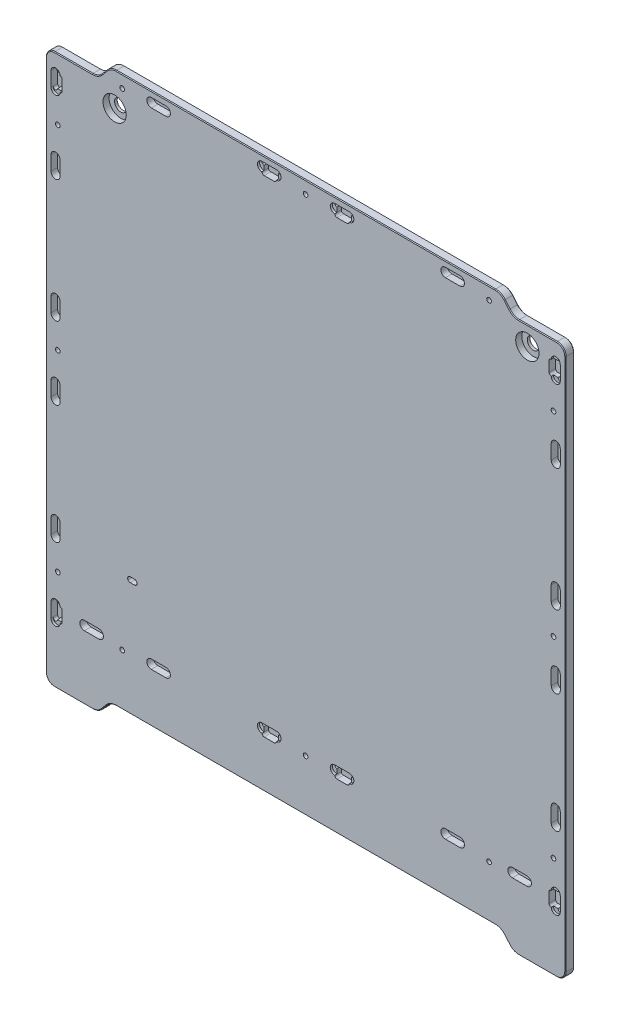
from build123d import *

# Parameters (mm, degrees)
CROQUIS1_W                                           = 357
CROQUIS1_H                                           = 388
SALIENTE_EXTRUIR1_DEPTH                              = 6
CORTAR_EXTRUIR1_DEPTH                                = 1.5
CORTAR_EXTRUIR2_DEPTH                                = 3
CORTAR_EXTRUIR3_DEPTH                                = 1.5
CORTAR_EXTRUIR4_DEPTH                                = 3
CORTAR_EXTRUIR5_DEPTH                                = 1.5
CORTAR_EXTRUIR6_DEPTH                                = 3
CORTAR_EXTRUIR7_DEPTH                                = 1.5
CORTAR_EXTRUIR8_DEPTH                                = 3
CROQUIS10_W                                          = 44.391351397
CROQUIS10_H                                          = 10.000423175
CORTAR_EXTRUIR9_DEPTH                                = 264.693477356
CROQUIS11_W                                          = 268.217297206
CROQUIS11_H                                          = 10.000423175
CORTAR_EXTRUIR10_DEPTH                               = 264.693477356
CORTAR_EXTRUIR11_DEPTH                               = 264.693477356
CORTAR_EXTRUIR12_DEPTH                               = 4.5
CORTAR_EXTRUIR13_DEPTH                               = 4.5
CORTAR_EXTRUIR14_DEPTH                               = 4.5
CORTAR_EXTRUIR15_DEPTH                               = 4.5
CORTAR_EXTRUIR16_DEPTH                               = 4.5
CORTAR_EXTRUIR17_DEPTH                               = 4.5
CORTAR_EXTRUIR18_DEPTH                               = 4.5
NGULO_DE_SALIDA1_ANGLE                               = 40
NGULO_DE_SALIDA2_ANGLE                               = 40
DI_METRO_DE_TALADRO_3_2_3_2_1_D                      = 3.2
DI_METRO_DE_TALADRO_3_2_3_2_2_D                      = 3.2
REFRENTADO_PARA_PERNO_CON_CABEZA_HEXAGON_D           = 8.5
REFRENTADO_PARA_PERNO_CON_CABEZA_HEXAGON_CBORE_D     = 16
REFRENTADO_PARA_PERNO_CON_CABEZA_HEXAGON_CBORE_DEPTH = 4.2
REDONDEO1_R                                          = 6
REDONDEO2_R                                          = 8.5
CHAFL_N1_SIZE                                        = 0.5
REDONDEO3_R                                          = 1.5


with BuildPart() as part:
    # Croquis1 → Saliente-Extruir1 (new body)
    with BuildSketch(Plane.XY.offset(3)):
        Rectangle(CROQUIS1_W, CROQUIS1_H)
    extrude(amount=-SALIENTE_EXTRUIR1_DEPTH)

    # Croquis2 → Cortar-Extruir1 (cut)
    with BuildSketch(Plane.XY.offset(3)):
        with BuildLine():
            Line((-20, 182.4), (-20, 183.9))
            ThreePointArc((-20, 183.9), (-16.9, 187), (-20, 190.1))
            Line((-20, 190.1), (-30, 190.1))
            ThreePointArc((-30, 190.1), (-33.1, 187), (-30, 183.9))
            Line((-30, 183.9), (-30, 182.4))
            Line((-30, 182.4), (-20, 182.4))
        make_face()
    cortar_extruir1 = extrude(amount=-CORTAR_EXTRUIR1_DEPTH, mode=Mode.SUBTRACT)

    # Croquis3 → Cortar-Extruir2 (cut)
    with BuildSketch(Plane.XY.offset(1.5)):
        with BuildLine():
            Line((-20, 190.1), (-30, 190.1))
            ThreePointArc((-30, 190.1), (-31.5, 188.6), (-30, 187.1))
            Line((-30, 187.1), (-30, 182.4))
            Line((-30, 182.4), (-20, 182.4))
            Line((-20, 182.4), (-20, 187.1))
            ThreePointArc((-20, 187.1), (-18.5, 188.6), (-20, 190.1))
        make_face()
    cortar_extruir2 = extrude(amount=-CORTAR_EXTRUIR2_DEPTH, mode=Mode.SUBTRACT)

    # Croquis4 → Cortar-Extruir3 (cut)
    with BuildSketch(Plane.XY.offset(3)):
        with BuildLine():
            Line((-167.2, 171.7), (-168.7, 171.7))
            ThreePointArc((-168.7, 171.7), (-171.8, 174.8), (-174.9, 171.7))
            Line((-174.9, 171.7), (-174.9, 161.7))
            ThreePointArc((-174.9, 161.7), (-171.8, 158.6), (-168.7, 161.7))
            Line((-168.7, 161.7), (-167.2, 161.7))
            Line((-167.2, 161.7), (-167.2, 171.7))
        make_face()
    cortar_extruir3 = extrude(amount=-CORTAR_EXTRUIR3_DEPTH, mode=Mode.SUBTRACT)

    # Croquis5 → Cortar-Extruir4 (cut)
    with BuildSketch(Plane.XY.offset(1.5)):
        with BuildLine():
            Line((-171.9, 161.7), (-167.2, 161.7))
            Line((-167.2, 161.7), (-167.2, 171.7))
            Line((-167.2, 171.7), (-171.9, 171.7))
            ThreePointArc((-171.9, 171.7), (-173.4, 173.2), (-174.9, 171.7))
            Line((-174.9, 171.7), (-174.9, 161.7))
            ThreePointArc((-174.9, 161.7), (-173.4, 160.2), (-171.9, 161.7))
        make_face()
    cortar_extruir4 = extrude(amount=-CORTAR_EXTRUIR4_DEPTH, mode=Mode.SUBTRACT)

    # Croquis6 → Cortar-Extruir5 (cut)
    with BuildSketch(Plane.XY.offset(3)):
        with BuildLine():
            Line((-167.2, -144.2), (-168.7, -144.2))
            ThreePointArc((-168.7, -144.2), (-171.8, -141.1), (-174.9, -144.2))
            Line((-174.9, -144.2), (-174.9, -154.2))
            ThreePointArc((-174.9, -154.2), (-171.8, -157.3), (-168.7, -154.2))
            Line((-168.7, -154.2), (-167.2, -154.2))
            Line((-167.2, -154.2), (-167.2, -144.2))
        make_face()
    cortar_extruir5 = extrude(amount=-CORTAR_EXTRUIR5_DEPTH, mode=Mode.SUBTRACT)

    # Croquis7 → Cortar-Extruir6 (cut)
    with BuildSketch(Plane.XY.offset(1.5)):
        with BuildLine():
            Line((-171.9, -154.2), (-167.2, -154.2))
            Line((-167.2, -154.2), (-167.2, -144.2))
            Line((-167.2, -144.2), (-171.9, -144.2))
            ThreePointArc((-171.9, -144.2), (-173.4, -142.7), (-174.9, -144.2))
            Line((-174.9, -144.2), (-174.9, -154.2))
            ThreePointArc((-174.9, -154.2), (-173.4, -155.7), (-171.9, -154.2))
        make_face()
    cortar_extruir6 = extrude(amount=-CORTAR_EXTRUIR6_DEPTH, mode=Mode.SUBTRACT)

    # Croquis8 → Cortar-Extruir7 (cut)
    with BuildSketch(Plane.XY.offset(3)):
        with BuildLine():
            Line((-20, -151.6), (-20, -150.1))
            ThreePointArc((-20, -150.1), (-16.9, -147), (-20, -143.9))
            Line((-20, -143.9), (-30, -143.9))
            ThreePointArc((-30, -143.9), (-33.1, -147), (-30, -150.1))
            Line((-30, -150.1), (-30, -151.6))
            Line((-30, -151.6), (-20, -151.6))
        make_face()
    cortar_extruir7 = extrude(amount=-CORTAR_EXTRUIR7_DEPTH, mode=Mode.SUBTRACT)

    # Croquis9 → Cortar-Extruir8 (cut)
    with BuildSketch(Plane.XY.offset(1.5)):
        with BuildLine():
            Line((-30, -146.9), (-30, -151.6))
            Line((-30, -151.6), (-20, -151.6))
            Line((-20, -151.6), (-20, -146.9))
            ThreePointArc((-20, -146.9), (-18.5, -145.4), (-20, -143.9))
            Line((-20, -143.9), (-30, -143.9))
            ThreePointArc((-30, -143.9), (-31.5, -145.4), (-30, -146.9))
        make_face()
    cortar_extruir8 = extrude(amount=-CORTAR_EXTRUIR8_DEPTH, mode=Mode.SUBTRACT)

    # Croquis10 → Cortar-Extruir9 (cut, through all)
    with BuildSketch(Plane(origin=(0, 0, -3), x_dir=(-1, 0, 0), z_dir=(0, 0, -1))):
        with Locations((156.304324302, 188.999788413)):
            Rectangle(CROQUIS10_W, CROQUIS10_H)
    cortar_extruir9 = extrude(amount=-CORTAR_EXTRUIR9_DEPTH, mode=Mode.SUBTRACT)

    # Croquis11 → Cortar-Extruir10 (cut, through all)
    with BuildSketch(Plane(origin=(0, 0, -3), x_dir=(-1, 0, 0), z_dir=(0, 0, -1))):
        with Locations((0, -188.999788413)):
            Rectangle(CROQUIS11_W, CROQUIS11_H)
    extrude(amount=-CORTAR_EXTRUIR10_DEPTH, mode=Mode.SUBTRACT)

    # Croquis12 → Cortar-Extruir11 (cut, through all)
    with BuildSketch(Plane(origin=(0, 0, -3), x_dir=(-1, 0, 0), z_dir=(0, 0, -1))):
        with BuildLine():
            Line((120.5, -102.25), (117.5, -102.25))
            ThreePointArc((117.5, -102.25), (115.75, -104), (117.5, -105.75))
            Line((117.5, -105.75), (120.5, -105.75))
            ThreePointArc((120.5, -105.75), (122.25, -104), (120.5, -102.25))
        make_face()
    extrude(amount=-CORTAR_EXTRUIR11_DEPTH, mode=Mode.SUBTRACT)

    # Croquis13 → Cortar-Extruir12 (cut)
    with BuildSketch(Plane.XY.offset(3)):
        with BuildLine():
            Line((-106, 183.9), (-96, 183.9))
            ThreePointArc((-96, 183.9), (-92.9, 187), (-96, 190.1))
            Line((-96, 190.1), (-106, 190.1))
            ThreePointArc((-106, 190.1), (-109.1, 187), (-106, 183.9))
        make_face()
    cortar_extruir12 = extrude(amount=-CORTAR_EXTRUIR12_DEPTH, mode=Mode.SUBTRACT)

    # Croquis14 → Cortar-Extruir13 (cut)
    with BuildSketch(Plane.XY.offset(3)):
        with BuildLine():
            Line((-168.7, 111.7), (-168.7, 121.7))
            ThreePointArc((-168.7, 121.7), (-171.8, 124.8), (-174.9, 121.7))
            Line((-174.9, 121.7), (-174.9, 111.7))
            ThreePointArc((-174.9, 111.7), (-171.8, 108.6), (-168.7, 111.7))
        make_face()
    cortar_extruir13 = extrude(amount=-CORTAR_EXTRUIR13_DEPTH, mode=Mode.SUBTRACT)

    # Croquis15 → Cortar-Extruir14 (cut)
    with BuildSketch(Plane.XY.offset(3)):
        with BuildLine():
            Line((-168.7, 27.5), (-168.7, 37.5))
            ThreePointArc((-168.7, 37.5), (-171.8, 40.6), (-174.9, 37.5))
            Line((-174.9, 37.5), (-174.9, 27.5))
            ThreePointArc((-174.9, 27.5), (-171.8, 24.4), (-168.7, 27.5))
        make_face()
    cortar_extruir14 = extrude(amount=-CORTAR_EXTRUIR14_DEPTH, mode=Mode.SUBTRACT)

    # Croquis16 → Cortar-Extruir15 (cut)
    with BuildSketch(Plane.XY.offset(3)):
        with BuildLine():
            Line((-168.7, -22.5), (-168.7, -12.5))
            ThreePointArc((-168.7, -12.5), (-171.8, -9.4), (-174.9, -12.5))
            Line((-174.9, -12.5), (-174.9, -22.5))
            ThreePointArc((-174.9, -22.5), (-171.8, -25.6), (-168.7, -22.5))
        make_face()
    cortar_extruir15 = extrude(amount=-CORTAR_EXTRUIR15_DEPTH, mode=Mode.SUBTRACT)

    # Croquis17 → Cortar-Extruir16 (cut)
    with BuildSketch(Plane.XY.offset(3)):
        with BuildLine():
            Line((-168.7, -104.2), (-168.7, -94.2))
            ThreePointArc((-168.7, -94.2), (-171.8, -91.1), (-174.9, -94.2))
            Line((-174.9, -94.2), (-174.9, -104.2))
            ThreePointArc((-174.9, -104.2), (-171.8, -107.3), (-168.7, -104.2))
        make_face()
    cortar_extruir16 = extrude(amount=-CORTAR_EXTRUIR16_DEPTH, mode=Mode.SUBTRACT)

    # Croquis18 → Cortar-Extruir17 (cut)
    with BuildSketch(Plane.XY.offset(3)):
        with BuildLine():
            Line((-106, -150.1), (-96, -150.1))
            ThreePointArc((-96, -150.1), (-92.9, -147), (-96, -143.9))
            Line((-96, -143.9), (-106, -143.9))
            ThreePointArc((-106, -143.9), (-109.1, -147), (-106, -150.1))
        make_face()
    cortar_extruir17 = extrude(amount=-CORTAR_EXTRUIR17_DEPTH, mode=Mode.SUBTRACT)

    # Croquis19 → Cortar-Extruir18 (cut)
    with BuildSketch(Plane.XY.offset(3)):
        with BuildLine():
            Line((-152, -150.1), (-142, -150.1))
            ThreePointArc((-142, -150.1), (-138.9, -147), (-142, -143.9))
            Line((-142, -143.9), (-152, -143.9))
            ThreePointArc((-152, -143.9), (-155.1, -147), (-152, -150.1))
        make_face()
    cortar_extruir18 = extrude(amount=-CORTAR_EXTRUIR18_DEPTH, mode=Mode.SUBTRACT)

    # Simetría1: Cortar-Extruir1, Cortar-Extruir2, Cortar-Extruir3, Cortar-Extruir4, Cortar-Extruir5, Cortar-Extruir6, Cortar-Extruir7, Cortar-Extruir8, Cortar-Extruir9, Cortar-Extruir12, Cortar-Extruir13, Cortar-Extruir14, Cortar-Extruir15, Cortar-Extruir16, Cortar-Extruir17, Cortar-Extruir18 across plane
    add(cortar_extruir1.mirror(Plane(origin=(0, 0, 0), x_dir=(0, 0, 1), z_dir=(1, 0, 0))), mode=Mode.SUBTRACT)
    add(cortar_extruir2.mirror(Plane(origin=(0, 0, 0), x_dir=(0, 0, 1), z_dir=(1, 0, 0))), mode=Mode.SUBTRACT)
    add(cortar_extruir3.mirror(Plane(origin=(0, 0, 0), x_dir=(0, 0, 1), z_dir=(1, 0, 0))), mode=Mode.SUBTRACT)
    add(cortar_extruir4.mirror(Plane(origin=(0, 0, 0), x_dir=(0, 0, 1), z_dir=(1, 0, 0))), mode=Mode.SUBTRACT)
    add(cortar_extruir5.mirror(Plane(origin=(0, 0, 0), x_dir=(0, 0, 1), z_dir=(1, 0, 0))), mode=Mode.SUBTRACT)
    add(cortar_extruir6.mirror(Plane(origin=(0, 0, 0), x_dir=(0, 0, 1), z_dir=(1, 0, 0))), mode=Mode.SUBTRACT)
    add(cortar_extruir7.mirror(Plane(origin=(0, 0, 0), x_dir=(0, 0, 1), z_dir=(1, 0, 0))), mode=Mode.SUBTRACT)
    add(cortar_extruir8.mirror(Plane(origin=(0, 0, 0), x_dir=(0, 0, 1), z_dir=(1, 0, 0))), mode=Mode.SUBTRACT)
    add(cortar_extruir9.mirror(Plane(origin=(0, 0, 0), x_dir=(0, 0, 1), z_dir=(1, 0, 0))), mode=Mode.SUBTRACT)
    add(cortar_extruir12.mirror(Plane(origin=(0, 0, 0), x_dir=(0, 0, 1), z_dir=(1, 0, 0))), mode=Mode.SUBTRACT)
    add(cortar_extruir13.mirror(Plane(origin=(0, 0, 0), x_dir=(0, 0, 1), z_dir=(1, 0, 0))), mode=Mode.SUBTRACT)
    add(cortar_extruir14.mirror(Plane(origin=(0, 0, 0), x_dir=(0, 0, 1), z_dir=(1, 0, 0))), mode=Mode.SUBTRACT)
    add(cortar_extruir15.mirror(Plane(origin=(0, 0, 0), x_dir=(0, 0, 1), z_dir=(1, 0, 0))), mode=Mode.SUBTRACT)
    add(cortar_extruir16.mirror(Plane(origin=(0, 0, 0), x_dir=(0, 0, 1), z_dir=(1, 0, 0))), mode=Mode.SUBTRACT)
    add(cortar_extruir17.mirror(Plane(origin=(0, 0, 0), x_dir=(0, 0, 1), z_dir=(1, 0, 0))), mode=Mode.SUBTRACT)
    add(cortar_extruir18.mirror(Plane(origin=(0, 0, 0), x_dir=(0, 0, 1), z_dir=(1, 0, 0))), mode=Mode.SUBTRACT)

    # Ángulo de salida1
    ngulo_de_salida1_faces = [part.faces().sort_by_distance(p)[0] for p in [
        (134.108648603, 188.999788413, 0),
        (-134.108648603, 188.999788413, 0),
    ]]
    draft(ngulo_de_salida1_faces, Plane(origin=(178.5, 194, -3), x_dir=(1, 0, 0), z_dir=(0, 1, 0)), NGULO_DE_SALIDA1_ANGLE)

    # Ángulo de salida2
    ngulo_de_salida2_faces = [part.faces().sort_by_distance(p)[0] for p in [
        (-134.108648603, -188.999788413, 0),
        (134.108648603, -188.999788413, 0),
    ]]
    draft(ngulo_de_salida2_faces, Plane(origin=(-134.108648603, -183.999576825, 3.000025), x_dir=(0, 0, -1), z_dir=(0, -1, 0)), NGULO_DE_SALIDA2_ANGLE)

    # Diámetro de taladro Ø3.2 (3.2)1 (through all)
    with Locations(Plane.XY.offset(3)):
        with Locations((170.25, -124.3), (170.25, 7.6), (170.25, 141.7), (126, 185.45), (126, -148.55)):
            Hole(DI_METRO_DE_TALADRO_3_2_3_2_1_D / 2)

    # Diámetro de taladro Ø3.2 (3.2)2 (through all)
    with Locations(Plane(origin=(0, 0, -3), x_dir=(-1, 0, 0), z_dir=(0, 0, -1))):
        with Locations((0, 185.45), (0, -148.55), (170.25, -124.3), (170.25, 7.6), (170.25, 141.7), (126, 185.45), (126, -148.55)):
            Hole(DI_METRO_DE_TALADRO_3_2_3_2_2_D / 2)

    # Refrentado para perno con cabeza hexagonal de M81 (through all)
    with Locations(Plane.XY.offset(3)):
        with Locations((-131.2, 171), (152.3, 171)):
            CounterBoreHole(REFRENTADO_PARA_PERNO_CON_CABEZA_HEXAGON_D / 2, REFRENTADO_PARA_PERNO_CON_CABEZA_HEXAGON_CBORE_D / 2, REFRENTADO_PARA_PERNO_CON_CABEZA_HEXAGON_CBORE_DEPTH)

    # Redondeo1
    redondeo1_edges = [part.edges().sort_by_distance(p)[0] for p in [
        (-178.5, 183.999576825, 0),
        (178.5, 183.999576825, 0),
        (178.5, -194, 0),
        (-178.5, -194, 0),
    ]]
    fillet(redondeo1_edges, radius=REDONDEO1_R)

    # Redondeo2
    redondeo2_edges = [part.edges().sort_by_distance(p)[0] for p in [
        (-134.108648603, 194, 0),
        (-142.5, 183.999576825, 0),
        (142.5, -194, 0),
        (134.108648603, -183.999576825, 0),
        (-134.108648603, -183.999576825, 0),
        (-142.5, -194, 0),
        (134.108648603, 194, 0),
        (142.5, 183.999576825, 0),
    ]]
    fillet(redondeo2_edges, radius=REDONDEO2_R)

    # Chaflán1
    chafl_n1_edges = [part.edges().sort_by_distance(p)[0] for p in [
        (159.481807547, 183.999576825, 3),
        (178.5, -5.000211587, -3),
        (-159.481807547, -194, -3),
        (-178.5, -5.000211587, -3),
        (176.742640687, -192.242640687, -3),
        (-176.742640687, -192.242640687, -3),
        (-176.742640687, 182.242217513, -3),
        (176.742640687, 182.242217513, -3),
        (178.5, -5.000211587, 3),
        (-159.481807547, 183.999576825, 3),
        (-178.5, -5.000211587, 3),
        (-159.481807547, -194, 3),
        (176.742640687, -192.242640687, 3),
        (-176.742640687, -192.242640687, 3),
        (-176.742640687, 182.242217513, 3),
        (176.742640687, 182.242217513, 3),
        (0, 194, 3),
        (0, 194, -3),
        (159.481807547, 183.999576825, -3),
        (159.481807547, -194, -3),
        (138.304324301, -188.999788413, -3),
        (0, -183.999576825, -3),
        (-138.304324301, -188.999788413, -3),
        (-159.481807547, 183.999576825, -3),
        (-138.304324301, 188.999788413, -3),
        (138.304324301, 188.999788413, -3),
        (-142.87135987, -193.20361619, -3),
        (-133.737288733, 193.20361619, -3),
        (142.87135987, -193.20361619, -3),
        (133.737288733, 193.20361619, -3),
        (138.304324301, 188.999788413, 3),
        (-138.304324301, 188.999788413, 3),
        (-138.304324301, -188.999788413, 3),
        (0, -183.999576825, 3),
        (138.304324301, -188.999788413, 3),
        (159.481807547, -194, 3),
        (-142.87135987, -193.20361619, 3),
        (-133.737288733, 193.20361619, 3),
        (142.87135987, -193.20361619, 3),
        (133.737288733, 193.20361619, 3),
        (-142.87135987, 184.795960636, -3),
        (-142.87135987, 184.795960636, 3),
        (142.87135987, 184.795960636, -3),
        (142.87135987, 184.795960636, 3),
        (133.737288733, -184.795960636, -3),
        (133.737288733, -184.795960636, 3),
        (-133.737288733, -184.795960636, -3),
        (-133.737288733, -184.795960636, 3),
    ]]
    chamfer(chafl_n1_edges, length=CHAFL_N1_SIZE)

    # Redondeo3
    redondeo3_edges = [part.edges().sort_by_distance(p)[0] for p in [
        (167.2, -144.2, 0.75),
        (20, 182.4, 0.75),
        (-30, -151.6, 0.75),
        (167.2, -154.2, 0.75),
        (167.2, 171.7, 0.75),
        (30, -151.6, 0.75),
        (-167.2, -144.2, 0.75),
        (-30, 182.4, 0.75),
        (-20, -151.6, 0.75),
        (-20, 182.4, 0.75),
        (30, 182.4, 0.75),
        (-167.2, 161.7, 0.75),
        (167.2, 161.7, 0.75),
        (-167.2, 171.7, 0.75),
        (-167.2, -154.2, 0.75),
        (20, -151.6, 0.75),
    ]]
    fillet(redondeo3_edges, radius=REDONDEO3_R - 0.0001)  # a hair under: the kernel refuses the full size


solid = part.part
